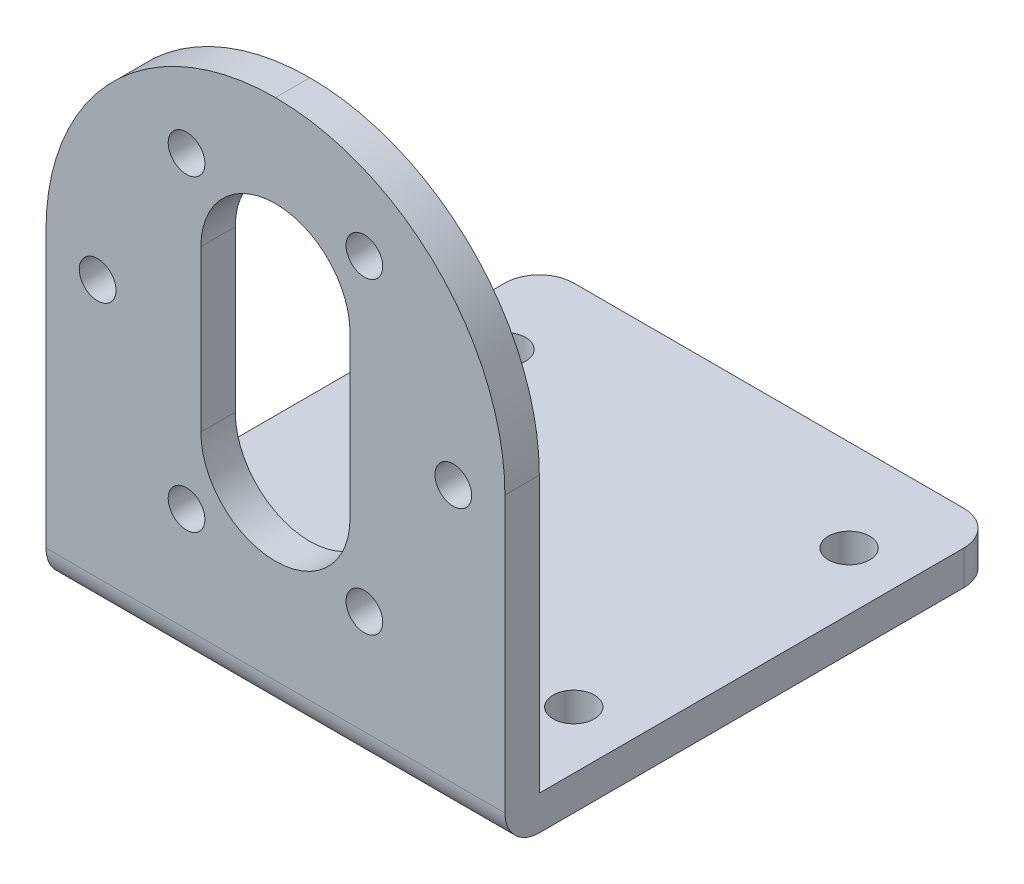
from build123d import *

# Parameters (mm, degrees)
SKETCH_1_W          = 40
SKETCH_1_H          = 43
SKETCH_1_R          = 1.8
EXTRUDE_1_DEPTH     = 3
SKETCH_2_W          = 40
SKETCH_2_H          = 3
EXTRUDE_2_DEPTH     = 44
SKETCH_3_R          = 1.6
CUT_EXTRUDE_1_DEPTH = 44
FILLET_1_R          = 20
FILLET_2_R          = 3
FILLET_3_R          = 3
FILLET_4_R          = 3


with BuildPart() as part:
    # 草图1 → 凸台-拉伸1 (new body)
    with BuildSketch(Plane(origin=(0, 0, 0), x_dir=(1, 0, 0), z_dir=(0, 1, 0))):
        Rectangle(SKETCH_1_W, SKETCH_1_H)
        with Locations(Location((-15, 13.5, 0), (0, 0, 270))):
            Circle(SKETCH_1_R, mode=Mode.SUBTRACT)
        with Locations(Location((15, 13.5, 0), (0, 0, 270))):
            Circle(SKETCH_1_R, mode=Mode.SUBTRACT)
        with Locations(Location((15, -10.5, 0), (0, 0, 270))):
            Circle(SKETCH_1_R, mode=Mode.SUBTRACT)
        with Locations(Location((-15, -10.5, 0), (0, 0, 270))):
            Circle(SKETCH_1_R, mode=Mode.SUBTRACT)
    extrude(amount=EXTRUDE_1_DEPTH)

    # 草图2 → 凸台-拉伸2 (add)
    with BuildSketch(Plane(origin=(0, 3, 0), x_dir=(1, 0, 0), z_dir=(0, 1, 0))):
        with Locations((0, -20)):
            Rectangle(SKETCH_2_W, SKETCH_2_H)
    extrude(amount=EXTRUDE_2_DEPTH)

    # 草图3 → 切除-拉伸1 (cut)
    with BuildSketch(Plane(origin=(0, 0, 18.5), x_dir=(-1, 0, 0), z_dir=(0, 0, -1))):
        with Locations((15.5, 25.5)):
            Circle(SKETCH_3_R)
        with Locations((-15.5, 25.5)):
            Circle(SKETCH_3_R)
        with Locations((-7.75, 38.923393759)):
            Circle(SKETCH_3_R)
        with Locations((-7.75, 12.076606241)):
            Circle(SKETCH_3_R)
        with Locations((7.75, 12.076606241)):
            Circle(SKETCH_3_R)
        with Locations((7.75, 38.923393759)):
            Circle(SKETCH_3_R)
        with BuildLine():
            Line((6.5, 32.5), (6.5, 18.5))
            ThreePointArc((6.5, 18.5), (0, 12), (-6.5, 18.5))
            Line((-6.5, 18.5), (-6.5, 32.5))
            ThreePointArc((-6.5, 32.5), (0, 39), (6.5, 32.5))
        make_face()
    extrude(amount=-CUT_EXTRUDE_1_DEPTH, mode=Mode.SUBTRACT)

    # 圆角1
    fillet_1_edges = [part.edges().sort_by_distance(p)[0] for p in [
        (-20, 47, 20),
        (20, 47, 20),
    ]]
    fillet(fillet_1_edges, radius=FILLET_1_R - 0.0001)  # a hair under: the kernel refuses the full size

    # 圆角2
    fillet_2_edges = [part.edges().sort_by_distance(p)[0] for p in [
        (20, 1.5, -21.5),
    ]]
    fillet(fillet_2_edges, radius=FILLET_2_R)

    # 圆角3
    fillet_3_edges = [part.edges().sort_by_distance(p)[0] for p in [
        (-20, 1.5, -21.5),
    ]]
    fillet(fillet_3_edges, radius=FILLET_3_R)

    # 圆角4
    fillet_4_edges = [part.edges().sort_by_distance(p)[0] for p in [
        (0, 0, 21.5),
    ]]
    fillet(fillet_4_edges, radius=FILLET_4_R)


solid = part.part
